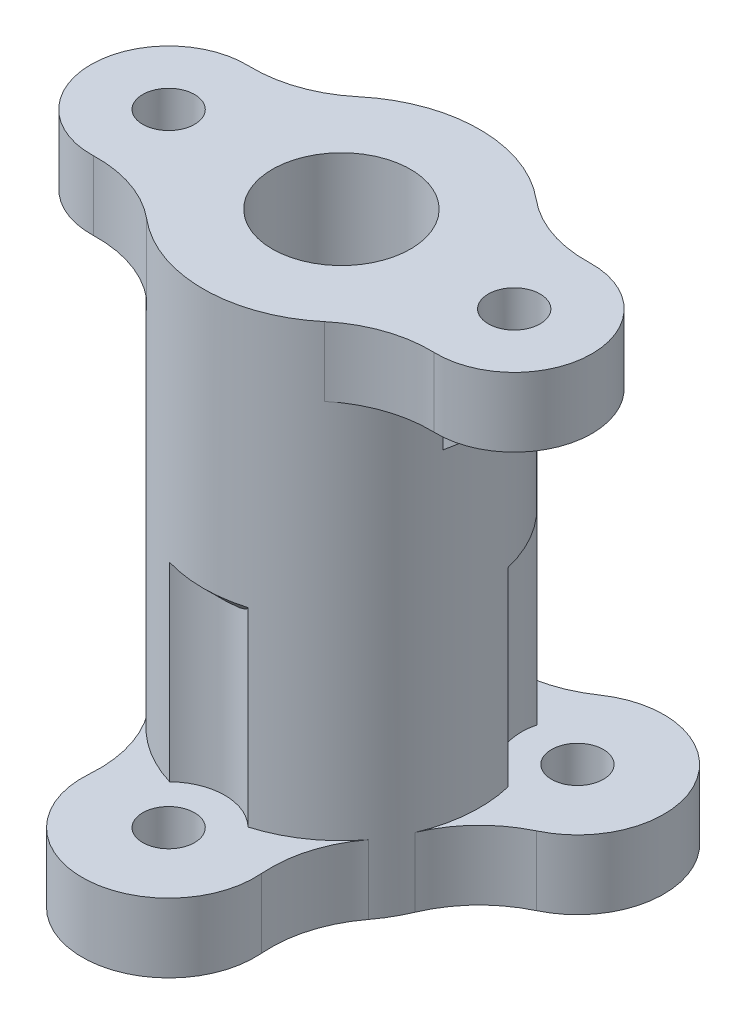
from build123d import *

# Parameters (mm, degrees)
SKETCH1_R               = 8
SKETCH1_R_2             = 4
BOSS_EXTRUDE1_DEPTH     = 30
SKETCH2_R               = 4.5
SKETCH2_R_2             = 1.5
BOSS_EXTRUDE2_DEPTH     = 4
FILLET1_R               = 7
SKETCH3_R               = 5
SKETCH3_R_2             = 1.5
BOSS_EXTRUDE3_DEPTH     = 4
FILLET2_R               = 7
SKETCH4_R               = 3.25
CUT_EXTRUDE1_DEPTH      = 10
CHAMFER1_SIZE           = 1
CUT_EXTRUDE2_DEPTH      = 1.5
CUT_EXTRUDE2_DEPTH_BACK = 1.5
CHAMFER2_SIZE           = 1.732050808
CHAMFER2_SIZE_2         = 1
CHAMFER3_SIZE           = 1.732050808
CHAMFER3_SIZE_2         = 1


with BuildPart() as part:
    # Sketch1 → Boss-Extrude1 (new body)
    with BuildSketch(Plane(origin=(0, 0, 0), x_dir=(1, 0, 0), z_dir=(0, 1, 0))):
        with Locations(Location((0, 0, 0), (0, 0, 270))):
            Circle(SKETCH1_R)
        with Locations(Location((0, 0, 0), (0, 0, 270))):
            Circle(SKETCH1_R_2, mode=Mode.SUBTRACT)
    extrude(amount=BOSS_EXTRUDE1_DEPTH)

    # Sketch2 → Boss-Extrude2 (add)
    # profile 1 of 2: a face of its own
    with BuildSketch(Plane(origin=(0, 30, 0), x_dir=(1, 0, 0), z_dir=(0, 1, 0))):
        with Locations((-10, 0)):
            Circle(SKETCH2_R)
        with Locations(Location((-10, 0, 0), (0, 0, 270))):
            Circle(SKETCH2_R_2, mode=Mode.SUBTRACT)
    # profile 2 of 2: a face of its own
    with BuildSketch(Plane(origin=(0, 30, 0), x_dir=(1, 0, 0), z_dir=(0, 1, 0))):
        with Locations((10, 0)):
            Circle(SKETCH2_R)
        with Locations(Location((10, 0, 0), (0, 0, 90))):
            Circle(SKETCH2_R_2, mode=Mode.SUBTRACT)
    extrude(amount=-BOSS_EXTRUDE2_DEPTH)

    # Fillet1
    fillet1_edges = [part.edges().sort_by_distance(p)[0] for p in [
        (-7.1875, 28, 3.512811374),
        (-7.1875, 28, -3.512811374),
        (7.1875, 28, -3.512811374),
        (7.1875, 28, 3.512811374),
    ]]
    fillet(fillet1_edges, radius=FILLET1_R)

    # Sketch3 → Boss-Extrude3 (add)
    # profile 1 of 3: a face of its own
    with BuildSketch(Plane.XZ):
        with Locations((0, 10)):
            Circle(SKETCH3_R)
        with Locations(Location((0, 10, 0), (0, 0, 270))):
            Circle(SKETCH3_R_2, mode=Mode.SUBTRACT)
    # profile 2 of 3: a face of its own
    with BuildSketch(Plane.XZ):
        with Locations((8.660254038, -5)):
            Circle(SKETCH3_R)
        with Locations(Location((8.660254038, -5, 0), (0, 0, 270))):
            Circle(SKETCH3_R_2, mode=Mode.SUBTRACT)
    # profile 3 of 3: a face of its own
    with BuildSketch(Plane.XZ):
        with Locations((-8.660254038, -5)):
            Circle(SKETCH3_R)
        with Locations(Location((-8.660254038, -5, 0), (0, 0, 270))):
            Circle(SKETCH3_R_2, mode=Mode.SUBTRACT)
    extrude(amount=-BOSS_EXTRUDE3_DEPTH)

    # Fillet2
    fillet2_edges = [part.edges().sort_by_distance(p)[0] for p in [
        (3.962007067, 2, 6.95),
        (-3.962007067, 2, 6.95),
        (4.037873023, 2, -6.90619877),
        (7.99988009, 2, -0.04380123),
        (-7.99988009, 2, -0.04380123),
        (-4.037873023, 2, -6.90619877),
    ]]
    fillet(fillet2_edges, radius=FILLET2_R)

    # Sketch4 → Cut-Extrude1 (cut)
    with BuildSketch(Plane(origin=(0, 4, 0), x_dir=(1, 0, 0), z_dir=(0, 1, 0))):
        with Locations((8.660254038, 5)):
            Circle(SKETCH4_R)
        with Locations((0, -10)):
            Circle(SKETCH4_R)
        with Locations((-8.660254038, 5)):
            Circle(SKETCH4_R)
    extrude(amount=CUT_EXTRUDE1_DEPTH, mode=Mode.SUBTRACT)

    # Chamfer1
    chamfer1_edges = [part.edges().sort_by_distance(p)[0] for p in [
        (-6.92820323, 14, -4),
        (1.145643924, 14, 7.917543811),
        (6.92820323, 14, -4),
    ]]
    chamfer(chamfer1_edges, length=CHAMFER1_SIZE)

    # Sketch5 → Cut-Extrude2 (cut, two sides: drawn at the far end of the back side and taken through both)
    with BuildSketch(Plane.XZ.offset(-26).offset(-CUT_EXTRUDE2_DEPTH_BACK)):
        Polygon((-10, 3.175426481), (-12.75, 1.58771324), (-12.75, -1.58771324), (-10, -3.175426481), (-7.25, -1.58771324), (-7.25, 1.58771324), align=None)
        Polygon((7.25, 1.58771324), (10, 3.175426481), (12.75, 1.58771324), (12.75, -1.58771324), (10, -3.175426481), (7.25, -1.58771324), align=None)
    extrude(amount=CUT_EXTRUDE2_DEPTH + CUT_EXTRUDE2_DEPTH_BACK, mode=Mode.SUBTRACT)

    # Chamfer2
    # the kernel refuses this chamfer: 1.732050808, 1 mm, written as the material it takes off along each edge
    with BuildSketch(Plane(origin=(0, 24.5, 0), x_dir=(-0.6976791075699221, 0, 0.7164104011392053), z_dir=(0.7164104011392053, 0, 0.6976791075699221))) as chamfer2_piece_1_section:
        Polygon((8, CHAMFER2_SIZE), (8 - CHAMFER2_SIZE_2, 0), (8, 0), align=None)
    chamfer2_piece_1 = revolve(axis=Axis((0, 24.5, 0), (0, -1, 0)), revolution_arc=91.517812411, mode=Mode.PRIVATE)
    chamfer2_piece_1 = split(chamfer2_piece_1, bisect_by=Plane(origin=(-6.887741649, 23.854160996, 1.378563284), z_dir=(-0.5000000000000001, 0, -0.8660254037844386)), keep=Keep.TOP, mode=Mode.PRIVATE)
    chamfer2_piece_1 = split(chamfer2_piece_1, bisect_by=Plane(origin=(-7.25, 23.854160996, 0), z_dir=(-1, 0, 0)), keep=Keep.TOP, mode=Mode.PRIVATE)
    chamfer2_piece_1 = split(chamfer2_piece_1, bisect_by=Plane(origin=(-6.887741649, 23.854160996, -1.378563284), z_dir=(-0.49999999999999994, 0, 0.8660254037844389)), keep=Keep.TOP, mode=Mode.PRIVATE)
    add(chamfer2_piece_1, mode=Mode.SUBTRACT)

    # Chamfer3
    # the kernel refuses this chamfer: 1.732050808, 1 mm, written as the material it takes off along each edge
    with BuildSketch(Plane(origin=(0, 24.5, 0), x_dir=(0.6976791075699224, 0, -0.7164104011392051), z_dir=(-0.7164104011392051, 0, -0.6976791075699224))) as chamfer3_piece_1_section:
        Polygon((8, CHAMFER3_SIZE), (8 - CHAMFER3_SIZE_2, 0), (8, 0), align=None)
    chamfer3_piece_1 = revolve(axis=Axis((0, 24.5, 0), (0, -1, 0)), revolution_arc=91.517812411, mode=Mode.PRIVATE)
    chamfer3_piece_1 = split(chamfer3_piece_1, bisect_by=Plane(origin=(6.887741649, 23.854160996, -1.378563284), z_dir=(0.49999999999999994, 0, 0.8660254037844389)), keep=Keep.TOP, mode=Mode.PRIVATE)
    chamfer3_piece_1 = split(chamfer3_piece_1, bisect_by=Plane(origin=(7.25, 23.854160996, 0), z_dir=(1, 0, 0)), keep=Keep.TOP, mode=Mode.PRIVATE)
    chamfer3_piece_1 = split(chamfer3_piece_1, bisect_by=Plane(origin=(6.887741649, 23.854160996, 1.378563284), z_dir=(0.5000000000000001, 0, -0.8660254037844386)), keep=Keep.TOP, mode=Mode.PRIVATE)
    add(chamfer3_piece_1, mode=Mode.SUBTRACT)


solid = part.part
